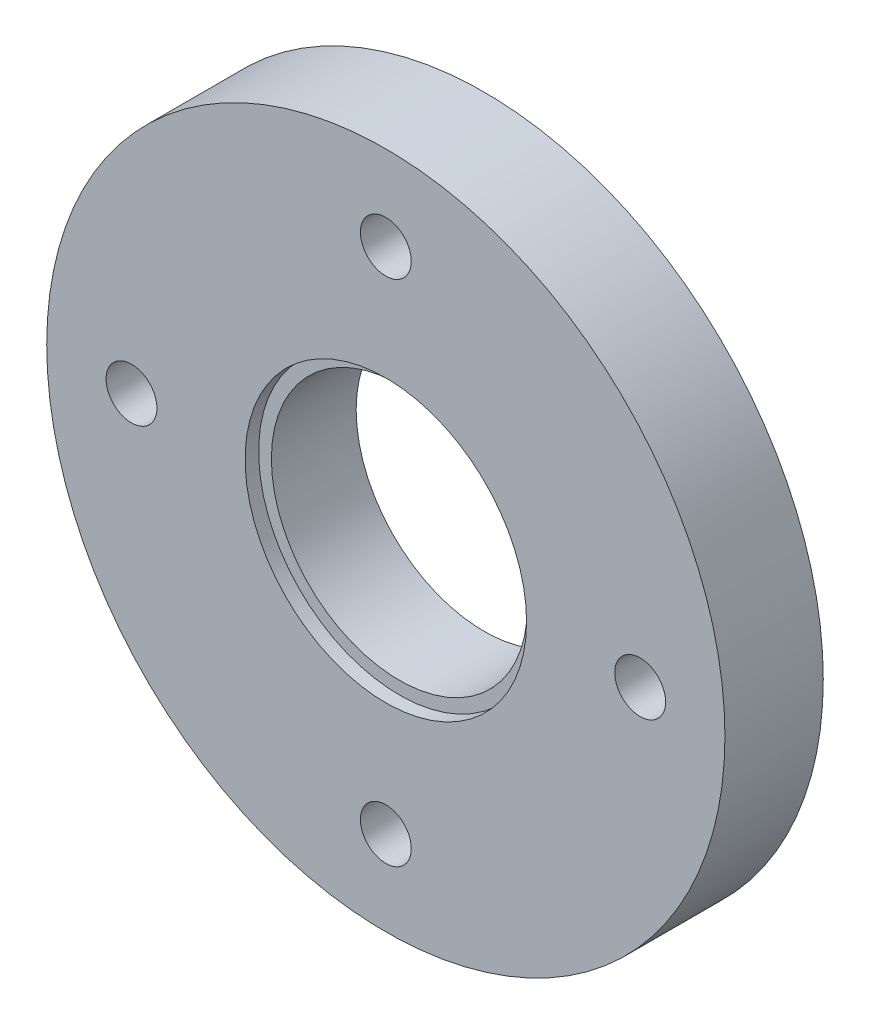
from build123d import *

# Parameters (mm, degrees)
SKETCH_1_R          = 20
SKETCH_1_R_2        = 7.55
SKETCH_1_R_3        = 1.5
EXTRUDE_1_DEPTH     = 5.8
SKETCH_2_R          = 8.3
CUT_EXTRUDE_1_DEPTH = 0.8


with BuildPart() as part:
    # ｽｹｯﾁ1 → ﾎﾞｽ - 押し出し1 (new body)
    with BuildSketch(Plane.XY):
        Circle(SKETCH_1_R)
        Circle(SKETCH_1_R_2, mode=Mode.SUBTRACT)
        with Locations((0, 15)):
            Circle(SKETCH_1_R_3, mode=Mode.SUBTRACT)
        with Locations((15, 0)):
            Circle(SKETCH_1_R_3, mode=Mode.SUBTRACT)
        with Locations((0, -15)):
            Circle(SKETCH_1_R_3, mode=Mode.SUBTRACT)
        with Locations((-15, 0)):
            Circle(SKETCH_1_R_3, mode=Mode.SUBTRACT)
    extrude(amount=EXTRUDE_1_DEPTH)

    # ｽｹｯﾁ2 → ｶｯﾄ - 押し出し1 (cut)
    with BuildSketch(Plane.XY.offset(5.8)):
        Circle(SKETCH_2_R)
    extrude(amount=-CUT_EXTRUDE_1_DEPTH, mode=Mode.SUBTRACT)


solid = part.part
